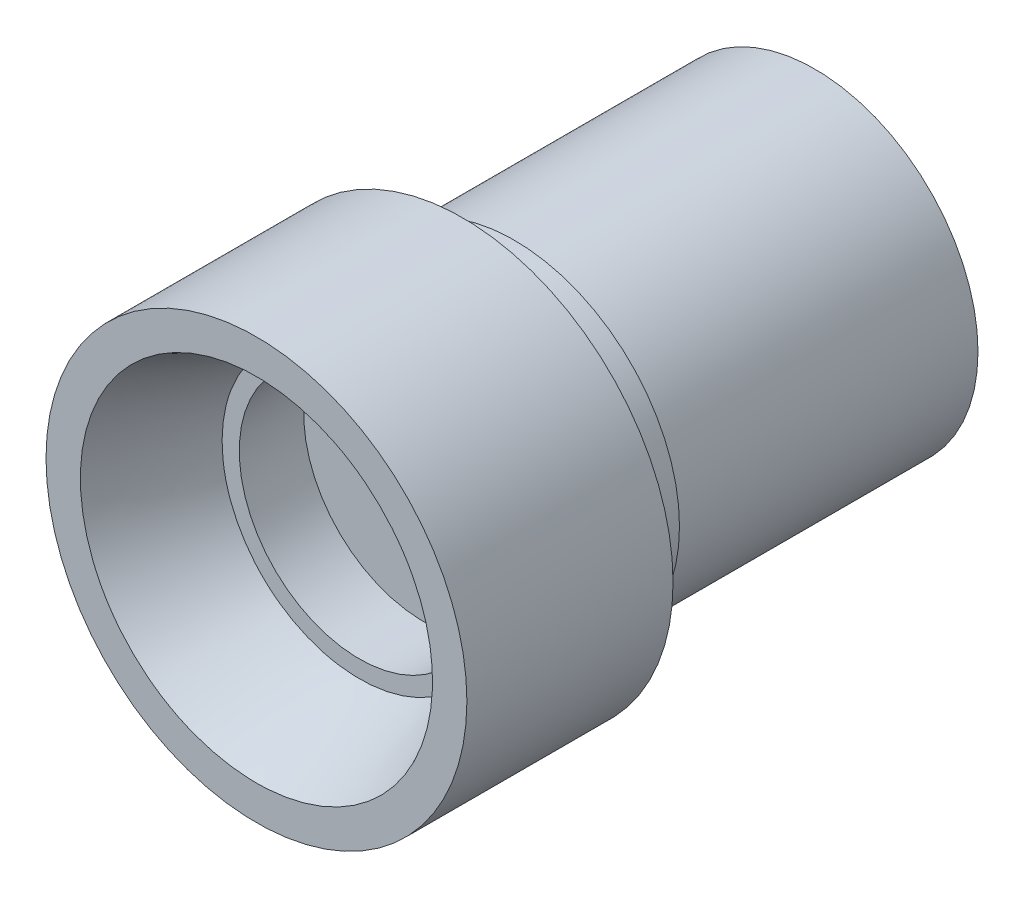
from build123d import *

# Parameters (mm, degrees)
SKETCH1_W         = 24
SKETCH1_H         = 24.5
SKETCH1_W_2       = 39
SKETCH1_H_2       = 19
CHAMFER9_SIZE     = 6
CHAMFER9_SIZE2    = 4
HOLE1_D           = 13
HOLE1_DEPTH       = 16
HOLE1_CBORE_D     = 28
HOLE1_CBORE_DEPTH = 7.5


with BuildPart() as part:
    # Sketch1 → Revolve2 (revolve)
    with BuildSketch(Plane(origin=(0, 0, 0), x_dir=(0, 0, -1), z_dir=(1, 0, 0)), mode=Mode.PRIVATE) as revolve2_sk:
        with Locations((12, 12.25)):
            Rectangle(SKETCH1_W, SKETCH1_H)
        Polygon((24, 19.25), (24, 0), (30, 0), (30, 19), (30, 19.25), align=None)
        with Locations((49.5, 9.5)):
            Rectangle(SKETCH1_W_2, SKETCH1_H_2)
    revolve(revolve2_sk.sketch.rotate(Axis((0, 0, 0), (0, 0, -1)), 90), axis=Axis((0, 0, 0), (0, 0, -1)))

    # Chamfer9
    chamfer9_edges = [part.edges().sort_by_distance(p)[0] for p in [
        (-19, 0, -69),
    ]]
    chamfer9_side = [part.faces().sort_by_distance(p)[0] for p in [
        (0, 0, -69),
    ]]
    chamfer(chamfer9_edges, length=CHAMFER9_SIZE, length2=CHAMFER9_SIZE2, reference=chamfer9_side[0])

    # Cut-Loft1: read off the stored shape, not the designer's step
    # Cut-Loft1: loft between two sections, ruled curve by curve
    cut_loft1_from = [
        Edge.make_bspline([(14.330823066, 14.658700837, 0), (43.648224741, -14.002945296, 0), (14.986578608, -43.32034697, 0), (-14.330823066, -14.658700837, 0), (-43.648224741, 14.002945296, 0), (-14.986578608, 43.32034697, 0), (14.330823066, 14.658700837, 0)], [0, 0, 0, 0, 0.5, 0.5, 0.5, 1, 1, 1, 1], 3, [1, 0.333333333, 0.333333333, 1, 0.333333333, 0.333333333, 1]),
    ]
    cut_loft1_to = [
        Edge.make_bspline([(13.812637818, 8.07533507, -12), (29.963307959, -19.549940567, -12), (2.338032322, -35.700610707, -12), (-13.812637818, -8.07533507, -12), (-29.963307959, 19.549940567, -12), (-2.338032322, 35.700610707, -12), (13.812637818, 8.07533507, -12)], [0, 0, 0, 0, 0.5, 0.5, 0.5, 1, 1, 1, 1], 3, [1, 0.333333333, 0.333333333, 1, 0.333333333, 0.333333333, 1]),
    ]
    cut_loft1 = Solid(Shell([*[Face.make_surface_from_curves(cut_loft1_from[k], cut_loft1_to[k]) for k in range(1)], Face(Wire(cut_loft1_from)), Face(Wire(cut_loft1_to))]))
    add(cut_loft1, mode=Mode.SUBTRACT)

    # Hole1
    with Locations(Plane.XY.offset(-12)):
        with Locations((0, 0)):
            CounterBoreHole(HOLE1_D / 2, HOLE1_CBORE_D / 2, HOLE1_CBORE_DEPTH, depth=HOLE1_DEPTH)


solid = part.part
